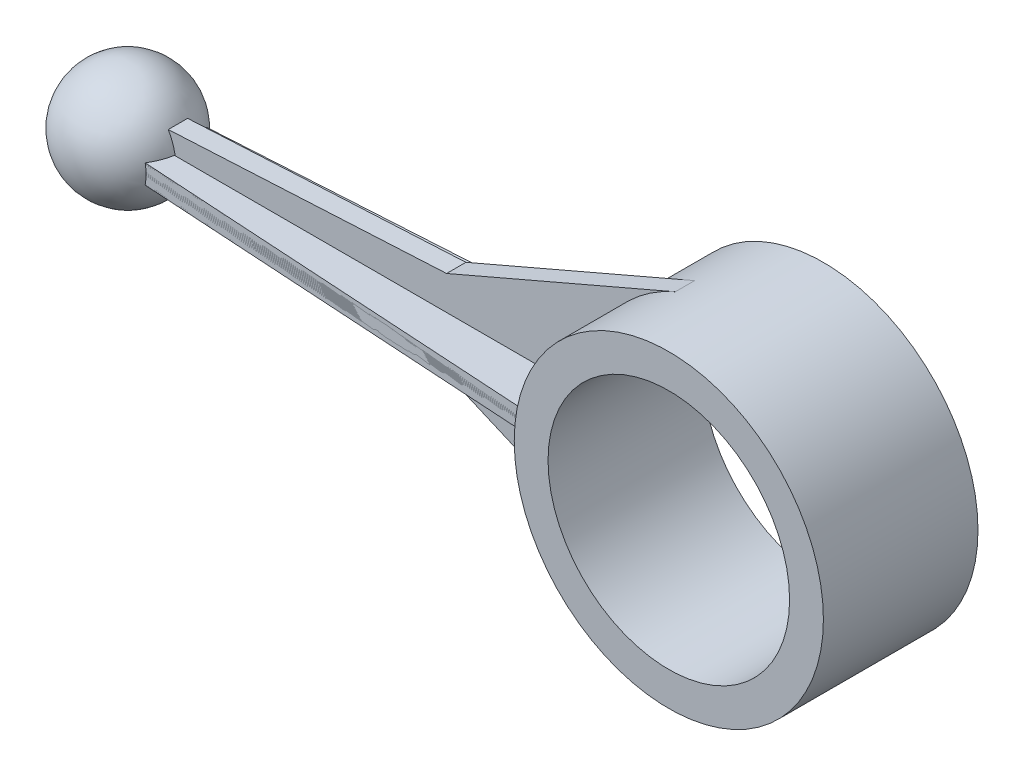
from build123d import *

# Parameters (mm, degrees)
ESQUISSE1_R             = 8
EXTRUSION1_DEPTH        = 4
ESQUISSE2_R             = 6.25
ENL_V_MAT_EXTRU_1_DEPTH = 14.856406461
EXTRUSION2_DEPTH        = 0.5
EXTRUSION5_DEPTH        = 0.5
SYM_TRIE4_START         = -0.5
SYM_TRIE4_DEPTH         = 1
SYM_TRIE4_2_DEPTH       = 1


with BuildPart() as part:
    # Esquisse1 → Extrusion1 (new, symmetric)
    with BuildSketch(Plane.XY):
        Circle(ESQUISSE1_R)
    extrude(amount=EXTRUSION1_DEPTH, both=True)

    # Esquisse2 → Enlèv. mat.-Extru.1 (cut, through all)
    with BuildSketch(Plane.XY.offset(4)):
        Circle(ESQUISSE2_R)
    extrude(amount=-ENL_V_MAT_EXTRU_1_DEPTH, mode=Mode.SUBTRACT)

    # Esquisse4 → Extrusion2 (add, symmetric)
    with BuildSketch(Plane.XY):
        with BuildLine():
            Line((-29, 0), (-8, 0))
            ThreePointArc((-8, 0), (-6.682676871, 4.397934723), (-3.164542542, 7.347494165))
            Line((-3.164542542, 7.347494165), (-15, 2.25))
            Line((-15, 2.25), (-29.401923789, 1.5))
            ThreePointArc((-29.401923789, 1.5), (-29.102222521, 0.776457135), (-29, 0))
        make_face()
    extrusion2 = extrude(amount=EXTRUSION2_DEPTH, both=True)

    # Symétrie1: Extrusion2 across plane
    add(extrusion2.mirror(Plane.ZX))

    # Sym_trie4 2 outline → Sym_trie4 2 (add)
    with BuildSketch(Plane(origin=(0, 0, 0), x_dir=(1, 0, 0), z_dir=(0, 1, 0)).offset(SYM_TRIE4_START)):
        Polygon((-31, -0.5), (-31, -1.5), (-7.984359711, -2.909120834), (-7.984359711, -0.5), align=None)
    extrude(amount=SYM_TRIE4_2_DEPTH)


with BuildPart() as body_2:
    # Esquisse3 → Révolution1 (revolve)
    with BuildSketch(Plane.XY):
        with BuildLine():
            Line((-32, 3), (-32, -3))
            ThreePointArc((-32, -3), (-35, 0), (-32, 3))
        make_face()
    revolve(axis=Axis((-32, 3, 0), (0, -1, 0)))

    # Symétrie4: read off the stored shape, not the designer's step
    # Symétrie4 outline → Symétrie4 (add)
    with BuildSketch(Plane(origin=(0, 0, 0), x_dir=(1, 0, 0), z_dir=(0, 1, 0)).offset(SYM_TRIE4_START)):
        Polygon((-6.5, -3), (-6.5, -0.5), (-30, -0.5), (-30, -1.56122449), (-29.506542384, -1.591436181), align=None)
    extrude(amount=SYM_TRIE4_DEPTH)


with BuildPart() as body_3:
    # Esquisse7 → Extrusion5 (new, symmetric)
    with BuildSketch(Plane(origin=(0, 0, 0), x_dir=(1, 0, 0), z_dir=(0, 1, 0))):
        Polygon((-31, 1.5), (-6.5, 3), (-6.5, 0.5), (-15, 0.5), (-31, 0.5), align=None)
    extrude(amount=EXTRUSION5_DEPTH, both=True)


solid = Compound([part.part, body_2.part, body_3.part])
